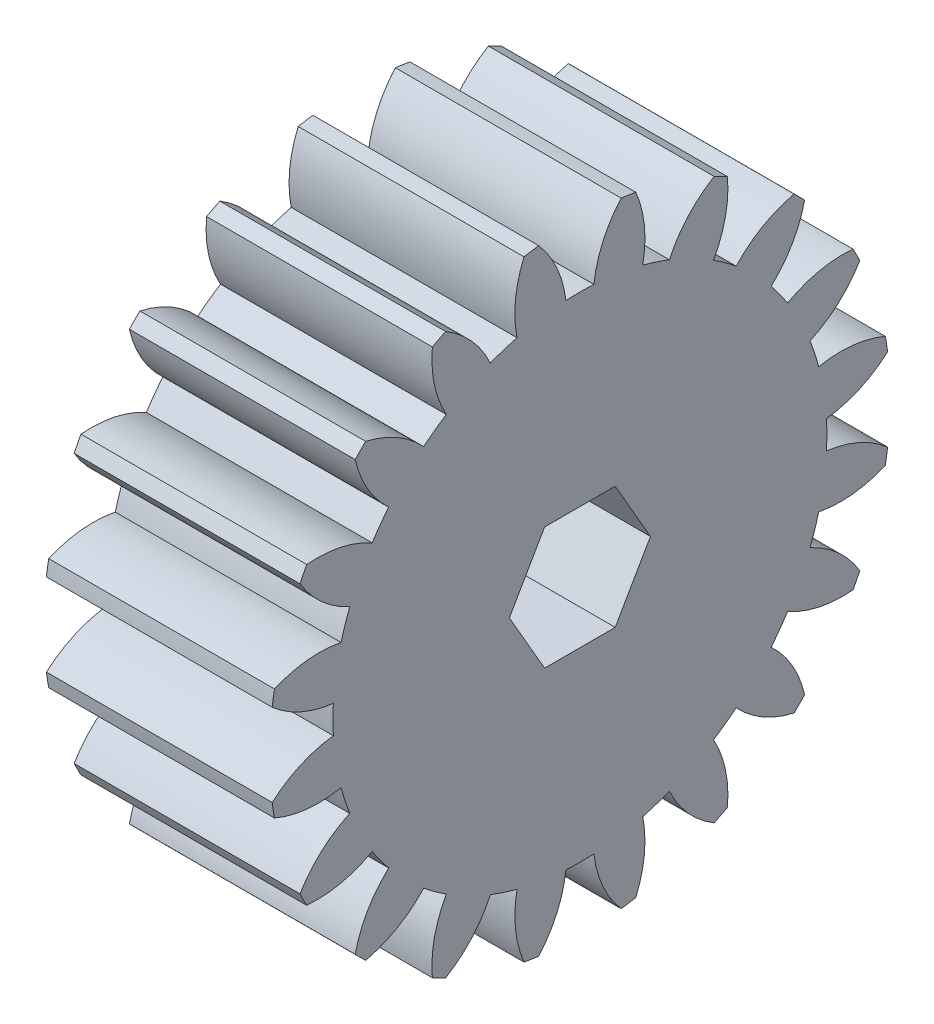
from build123d import *

# Parameters (mm, degrees)
BASPROSKE_W        = 12
BASPROSKE_H        = 16.5
TOOTHCUT_DEPTH     = 27.239283527
TEETHCUTS_COUNT    = 20
TEETHCUTS_ANGLE    = 342
BORSKE_R           = 2.5
BORE_DEPTH         = 50.0000508
CUT_EXTRUDE1_DEPTH = 27.055895681


with BuildPart() as part:
    # BasProSke → Base-Revolve (revolve)
    with BuildSketch(Plane(origin=(0, 0, 0), x_dir=(1, 0, 0), z_dir=(0, 1, 0))):
        with Locations((6, 8.25)):
            Rectangle(BASPROSKE_W, BASPROSKE_H)
    revolve(axis=Axis((-10, 0, 0), (1, 0, 0)))

    # TooCutSke → ToothCut (cut, through all)
    with BuildSketch(Plane(origin=(0, 0, 0), x_dir=(0, 0, -1), z_dir=(1, 0, 0))):
        with BuildLine():
            ThreePointArc((0.74381438, 13.102904875), (0, 13.124), (-0.74381438, 13.102904875))
            ThreePointArc((-0.74381438, 13.102904875), (-1.226473103, 14.852072512), (-2.209965745, 16.376962373))
            ThreePointArc((-2.209965745, 16.376962373), (0, 16.5254), (2.209965745, 16.376962373))
            ThreePointArc((2.209965745, 16.376962373), (1.226473103, 14.852072512), (0.74381438, 13.102904875))
        make_face()
    toothcut = extrude(amount=TOOTHCUT_DEPTH, mode=Mode.SUBTRACT)

    # TeethCuts: ToothCut ×20 about axis
    teethcuts_axis = Axis((-10, 0, 0), (1, 0, 0))
    for i in range(1, TEETHCUTS_COUNT):
        add(toothcut.rotate(teethcuts_axis, i * TEETHCUTS_ANGLE / (TEETHCUTS_COUNT - 1)), mode=Mode.SUBTRACT)

    # BorSke → Bore (cut, symmetric)
    with BuildSketch(Plane(origin=(0, 0, 0), x_dir=(0, 0, -1), z_dir=(1, 0, 0))):
        Circle(BORSKE_R)
    extrude(amount=BORE_DEPTH, both=True, mode=Mode.SUBTRACT)

    # Sketch1 → Cut-Extrude1 (cut, through all)
    with BuildSketch(Plane(origin=(12, 0, 0), x_dir=(0, 0, -1), z_dir=(1, 0, 0))):
        Polygon((3.75, 0), (1.875, 3.247595264), (-1.875, 3.247595264), (-3.75, 0), (-1.875, -3.247595264), (1.875, -3.247595264), align=None)
    extrude(amount=-CUT_EXTRUDE1_DEPTH, mode=Mode.SUBTRACT)


solid = part.part
